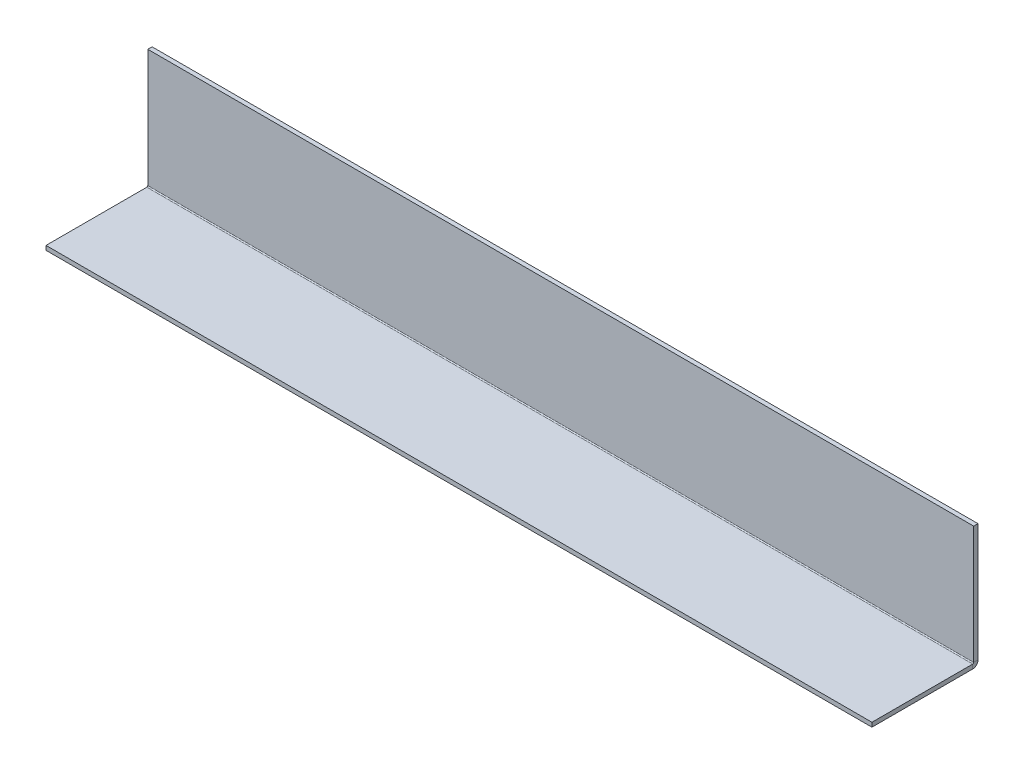
from build123d import *

# Parameters (mm, degrees)
SKETCH8_W              = 609.6
SKETCH8_H              = 171.45
BASE_FLANGE3_DEPTH     = 3.175
SKETCHED_START         = -304.8
SKETCHED_BEND3_DEPTH   = 609.6
SKETCHED_BEND3_2_DEPTH = 609.6
SKETCH19_W             = 609.6
SKETCH19_H             = 6.35
CUT_EXTRUDE1_DEPTH     = 327.160318745


# Read off the part's stored shape, not the designer's step: Sketched Bend3
# Sheet-metal steps are written as plain solids
with BuildPart() as part:
    # Sketch8 → Base-Flange3 (new body)
    with BuildSketch(Plane.XY):
        Rectangle(SKETCH8_W, SKETCH8_H)
    extrude(amount=-BASE_FLANGE3_DEPTH)

    # Sketched Bend3 outline → Sketched Bend3 (cut)
    with BuildSketch(Plane.YZ.offset(SKETCHED_START)):
        with BuildLine():
            ThreePointArc((-7.699656128, -3.175), (-10.191576071, -2.278520157), (-11.541274928, 0))
            Line((-11.541274928, 0), (-85.725, 0))
            Line((-85.725, 0), (-85.725, -3.175))
            Line((-85.725, -3.175), (-7.699656128, -3.175))
        make_face()
    extrude(amount=SKETCHED_BEND3_DEPTH, mode=Mode.SUBTRACT)

    # Sketched Bend3 2 outline → Sketched Bend3 2 (add)
    with BuildSketch(Plane.YZ.offset(SKETCHED_START)):
        with BuildLine():
            Line((-8.436256128, 75.111256128), (-11.611256128, 75.111256128))
            Line((-11.611256128, 75.111256128), (-11.611256128, 0.7366))
            ThreePointArc((-11.611256128, 0.7366), (-11.593721527, 0.366641581), (-11.541274928, 0))
            Line((-11.541274928, 0), (-7.699656128, 0))
            ThreePointArc((-7.699656128, 0), (-8.220510983, 0.215745145), (-8.436256128, 0.7366))
            Line((-8.436256128, 0.7366), (-8.436256128, 75.111256128))
        make_face()
    extrude(amount=SKETCHED_BEND3_2_DEPTH)

    # Sketch19 → Cut-Extrude1 (cut, through all)
    with BuildSketch(Plane(origin=(0, 0, -3.175), x_dir=(-1, 0, 0), z_dir=(0, 0, -1))):
        with Locations((0, 82.55)):
            Rectangle(SKETCH19_W, SKETCH19_H)
    extrude(amount=-CUT_EXTRUDE1_DEPTH, mode=Mode.SUBTRACT)


solid = part.part
